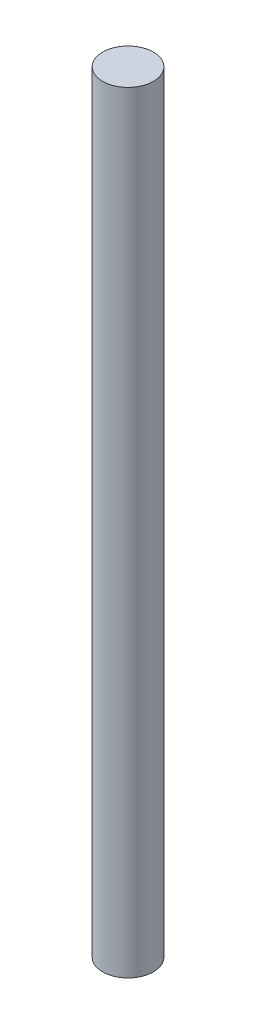
from build123d import *

# Parameters (mm, degrees)
SKETCH1_R           = 15.875
BOSS_EXTRUDE1_DEPTH = 482.6
SKETCH2_R           = 2.1971
CUT_EXTRUDE1_DEPTH  = 76.2


with BuildPart() as part:
    # Sketch1 → Boss-Extrude1 (new body)
    with BuildSketch(Plane(origin=(0, 0, 0), x_dir=(1, 0, 0), z_dir=(0, 1, 0))):
        Circle(SKETCH1_R)
    extrude(amount=BOSS_EXTRUDE1_DEPTH)

    # Sketch2 → Cut-Extrude1 (cut)
    with BuildSketch(Plane.XZ):
        with Locations((0, 11.43)):
            Circle(SKETCH2_R)
        with Locations((11.43, 0)):
            Circle(SKETCH2_R)
        with Locations((0, -11.43)):
            Circle(SKETCH2_R)
        with Locations((-11.43, 0)):
            Circle(SKETCH2_R)
    extrude(amount=-CUT_EXTRUDE1_DEPTH, mode=Mode.SUBTRACT)


solid = part.part
